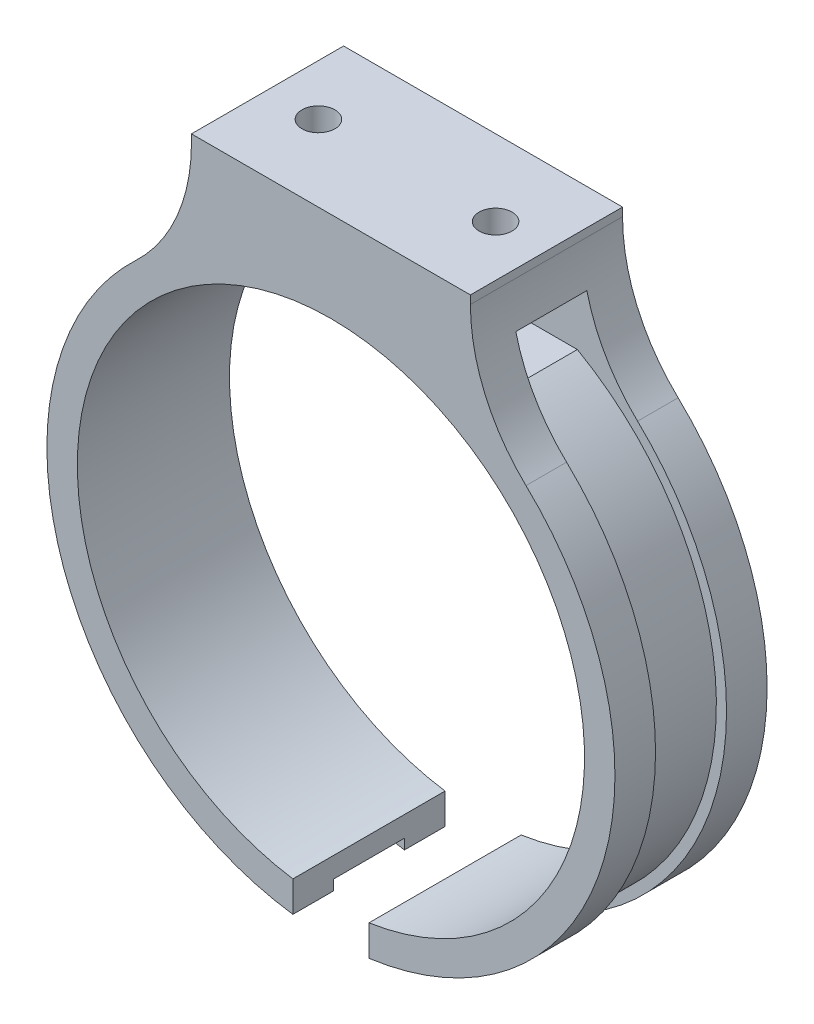
from build123d import *

# Parameters (mm, degrees)
SKETCH1_R                 = 56
SKETCH1_R_2               = 50
MAIN_SHAPE_DEPTH          = 15
HARNESS_REACH             = 82.604
HARNESS_DIRECTION_2_REACH = 82.604
HARNESS_FILLET_R          = 35
SKETCH3_R                 = 58
SKETCH3_R_2               = 54
MAIN_SLOT_DEPTH           = 7
BOLT_HOLES_REACH          = 138.686
SKETCH13_R                = 3.25
SKETCH15_W                = 15
SKETCH15_H                = 30
MAIN_KEYWAY_DEPTH         = 90.193564258
HARNESS_CUT_DEPTH         = 90.193564258
HARNESS_CUT_DEPTH_BACK    = 90.193564258
SKETCH19_W                = 14
SKETCH19_H                = 11


with BuildPart() as part:
    # Sketch1 → main shape (new, symmetric)
    with BuildSketch(Plane.XY):
        Circle(SKETCH1_R)
        Circle(SKETCH1_R_2, mode=Mode.SUBTRACT)
    extrude(amount=MAIN_SHAPE_DEPTH, both=True)

    # harness: up to this face of the body (flat: up to its plane)
    harness_end = Plane(part.part.faces().sort_by_distance((-54.41608081, 0, 15))[0])
    # Sketch11 → harness (add, up to the picked face)
    with BuildSketch(Plane.XY, mode=Mode.PRIVATE) as harness_sk1:
        with BuildLine():
            Line((27.5, 67.782681353), (27.5, 48.782681353))
            ThreePointArc((27.5, 48.782681353), (0, 56), (-27.5, 48.782681353))
            Line((-27.5, 48.782681353), (-27.5, 67.782681353))
            Line((-27.5, 67.782681353), (27.5, 67.782681353))
        make_face()
    harness_tool1 = split(extrude(harness_sk1.sketch, amount=HARNESS_REACH, mode=Mode.PRIVATE), bisect_by=harness_end, keep=Keep.BOTH, mode=Mode.PRIVATE)
    add(harness_tool1.solids().sort_by(Axis((0, 60.560729, 0), (0, 0, 1)))[0])

    # harness direction 2: up to this face of the body (flat: up to its plane)
    harness_direction_2_end = Plane(part.part.faces().sort_by_distance((-54.41608081, 0, -15))[0])
    # Sketch11 → harness direction 2 (add, up to the picked face)
    with BuildSketch(Plane.XY, mode=Mode.PRIVATE) as harness_direction_2_sk1:
        with BuildLine():
            Line((27.5, 67.782681353), (27.5, 48.782681353))
            ThreePointArc((27.5, 48.782681353), (0, 56), (-27.5, 48.782681353))
            Line((-27.5, 48.782681353), (-27.5, 67.782681353))
            Line((-27.5, 67.782681353), (27.5, 67.782681353))
        make_face()
    harness_direction_2_tool1 = split(extrude(harness_direction_2_sk1.sketch, amount=-HARNESS_DIRECTION_2_REACH, mode=Mode.PRIVATE), bisect_by=harness_direction_2_end, keep=Keep.BOTH, mode=Mode.PRIVATE)
    add(harness_direction_2_tool1.solids().sort_by(Axis((0, 60.560729, 0), (0, 0, -1)))[0])

    # harness fillet
    harness_fillet_edges = [part.edges().sort_by_distance(p)[0] for p in [
        (27.5, 48.782681353, 0),
        (-27.5, 48.782681353, 0),
    ]]
    fillet(harness_fillet_edges, radius=HARNESS_FILLET_R)

    # Sketch3 → main slot (cut, symmetric)
    with BuildSketch(Plane.XY):
        Circle(SKETCH3_R)
        Circle(SKETCH3_R_2, mode=Mode.SUBTRACT)
    extrude(amount=MAIN_SLOT_DEPTH, both=True, mode=Mode.SUBTRACT)

    # Sketch13 → bolt holes (cut, up to next)
    with BuildSketch(Plane(origin=(0, 67.782681353, 0), x_dir=(1, 0, 0), z_dir=(0, 1, 0)), mode=Mode.PRIVATE) as bolt_holes_sk1:
        with Locations((-17.4625, 0)):
            Circle(SKETCH13_R)
    bolt_holes_tool1 = extrude(bolt_holes_sk1.sketch, amount=-BOLT_HOLES_REACH, mode=Mode.PRIVATE) & part.part
    # Sketch13 → bolt holes (cut, up to next)
    with BuildSketch(Plane(origin=(0, 67.782681353, 0), x_dir=(1, 0, 0), z_dir=(0, 1, 0)), mode=Mode.PRIVATE) as bolt_holes_sk2:
        with Locations((17.4625, 0)):
            Circle(SKETCH13_R)
    bolt_holes_tool2 = extrude(bolt_holes_sk2.sketch, amount=-BOLT_HOLES_REACH, mode=Mode.PRIVATE) & part.part
    add(bolt_holes_tool1.solids().sort_by_distance((-17.4625, 67.782681, 0))[0], mode=Mode.SUBTRACT)
    add(bolt_holes_tool2.solids().sort_by_distance((17.4625, 67.782681, 0))[0], mode=Mode.SUBTRACT)

    # Sketch15 → main keyway (cut, through all)
    with BuildSketch(Plane(origin=(0, 0, 0), x_dir=(1, 0, 0), z_dir=(0, 1, 0))):
        Rectangle(SKETCH15_W, SKETCH15_H)
    extrude(amount=-MAIN_KEYWAY_DEPTH, mode=Mode.SUBTRACT)

    # Sketch19 → harness cut (cut, two sides: drawn at the far end of the back side and taken through both)
    with BuildSketch(Plane(origin=(0, 0, 0), x_dir=(0, 0, -1), z_dir=(1, 0, 0)).offset(-HARNESS_CUT_DEPTH_BACK)):
        with Locations((0, 52.5)):
            Rectangle(SKETCH19_W, SKETCH19_H)
    extrude(amount=HARNESS_CUT_DEPTH + HARNESS_CUT_DEPTH_BACK, mode=Mode.SUBTRACT)


solid = part.part
